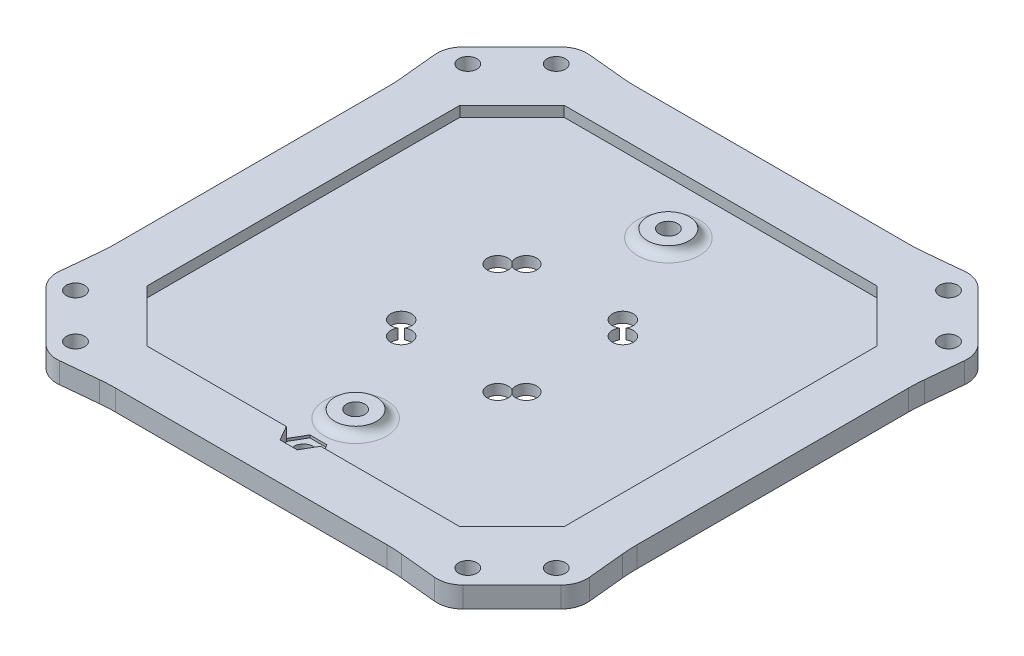
from build123d import *

# Parameters (mm, degrees)
SKETCH1_R                  = 1.75
BOSS_EXTRUDE1_DEPTH        = 4
CUT_EXTRUDE1_DEPTH         = 2
SKETCH4_R                  = 1.75
CUT_EXTRUDE3_DEPTH         = 73.238369544
BOSS_EXTRUDE2_START        = 1.5
SKETCH5_R                  = 4
SKETCH5_R_2                = 1.75
BOSS_EXTRUDE2_DEPTH        = 1.5
REDONDEO1_R                = 2
REDONDEO2_R                = 30
REDONDEO3_R                = 5
CORTAR_EXTRUIR2_DEPTH      = 2.5
CROQUIS1_R                 = 1.75
CORTAR_EXTRUIR1_DEPTH      = 5
CORTAR_EXTRUIR3_DEPTH      = 73.029377138
CORTAR_EXTRUIR3_DEPTH_BACK = 73.029377138
CROQUIS5_R                 = 2
CROQUIS6_W                 = 5.2
CROQUIS6_H                 = 3.2
CORTAR_EXTRUIR4_DEPTH      = 2.5


with BuildPart() as part:
    # Sketch1 → Boss-Extrude1 (new body)
    with BuildSketch(Plane(origin=(0, 0, 0), x_dir=(1, 0, 0), z_dir=(0, 1, 0))):
        Polygon((-27.516424079, 50), (27.516424079, 50), (38.33273811, 51.060660172), (51.060660172, 38.33273811), (50, 27.516424079), (50, -27.516424079), (51.060660172, -38.33273811), (38.33273811, -51.060660172), (27.516424079, -50), (-27.516424079, -50), (-38.33273811, -51.060660172), (-51.060660172, -38.33273811), (-50, -27.516424079), (-50, 27.516424079), (-51.060660172, 38.33273811), (-38.33273811, 51.060660172), align=None)
        with Locations(Location((37.625631329, 46.110912703, 0), (0, 0, 270))):
            Circle(SKETCH1_R, mode=Mode.SUBTRACT)
        with Locations(Location((46.110912703, 37.625631329, 0), (0, 0, 270))):
            Circle(SKETCH1_R, mode=Mode.SUBTRACT)
        with Locations(Location((37.625631329, -46.110912703, 0), (0, 0, 270))):
            Circle(SKETCH1_R, mode=Mode.SUBTRACT)
        with Locations(Location((46.110912703, -37.625631329, 0), (0, 0, 270))):
            Circle(SKETCH1_R, mode=Mode.SUBTRACT)
        with Locations(Location((-46.110912703, -37.625631329, 0), (0, 0, 270))):
            Circle(SKETCH1_R, mode=Mode.SUBTRACT)
        with Locations(Location((-37.625631329, -46.110912703, 0), (0, 0, 270))):
            Circle(SKETCH1_R, mode=Mode.SUBTRACT)
        with Locations(Location((-37.625631329, 46.110912703, 0), (0, 0, 270))):
            Circle(SKETCH1_R, mode=Mode.SUBTRACT)
        with Locations(Location((-46.110912703, 37.625631329, 0), (0, 0, 270))):
            Circle(SKETCH1_R, mode=Mode.SUBTRACT)
    extrude(amount=BOSS_EXTRUDE1_DEPTH)

    # Sketch2 → Cut-Extrude1 (cut)
    with BuildSketch(Plane(origin=(0, 4, 0), x_dir=(1, 0, 0), z_dir=(0, 1, 0))):
        Polygon((-40, -30), (-40, 30), (-30, 40), (30, 40), (40, 30), (40, -30), (30, -40), (-30, -40), align=None)
    extrude(amount=-CUT_EXTRUDE1_DEPTH, mode=Mode.SUBTRACT)

    # Sketch4 → Cut-Extrude3 (cut, through all)
    with BuildSketch(Plane(origin=(0, 2, 0), x_dir=(1, 0, 0), z_dir=(0, 1, 0))):
        with Locations(Location((0, 30, 0), (0, 0, 270))):
            Circle(SKETCH4_R)
    cut_extrude3 = extrude(amount=-CUT_EXTRUDE3_DEPTH, mode=Mode.SUBTRACT)

    # Sketch5 → Boss-Extrude2 (add)
    with BuildSketch(Plane(origin=(0, 2, 0), x_dir=(1, 0, 0), z_dir=(0, 1, 0)).offset(BOSS_EXTRUDE2_START)):
        with Locations(Location((0, 30, 0), (0, 0, 90))):
            Circle(SKETCH5_R)
        with Locations(Location((0, 30, 0), (0, 0, 270))):
            Circle(SKETCH5_R_2, mode=Mode.SUBTRACT)
    boss_extrude2 = extrude(amount=-BOSS_EXTRUDE2_DEPTH)

    # Simetría1: Cut-Extrude3, Boss-Extrude2 across plane
    add(cut_extrude3.mirror(Plane.XY), mode=Mode.SUBTRACT)
    add(boss_extrude2.mirror(Plane.XY))

    # Redondeo1
    # the kernel refuses this fillet: 2 mm, written as the material it adds along each edge
    with BuildSketch(Plane(origin=(0, 2, -30), x_dir=(0, 0, -1), z_dir=(1, 0, 0))) as redondeo1_piece_1:
        with BuildLine():
            CenterArc((5.936491673, 2), REDONDEO1_R, 194.477512186, 75.522487814)
            Line((4, 1.5), (3.961270167, 1.49))
            ThreePointArc((3.961270167, 1.49), (3.96, 0.75), (3.96, 0))
            Line((3.96, 0), (4, -0.04))
            Line((4, -0.04), (5.936491673, -0.04))
            Line((5.936491673, -0.04), (5.936491673, 0))
        make_face()
    revolve(axis=Axis((0, 2, -30), (0, 1, 0)))
    with BuildSketch(Plane(origin=(0, 2, 30), x_dir=(0, 0, 1), z_dir=(1, 0, 0))) as redondeo1_piece_2:
        with BuildLine():
            CenterArc((5.936491673, -2), REDONDEO1_R, 90, 75.522487814)
            Line((4, -1.5), (3.961270167, -1.49))
            ThreePointArc((3.961270167, -1.49), (3.96, -0.75), (3.96, 0))
            Line((3.96, 0), (4, 0.04))
            Line((4, 0.04), (5.936491673, 0.04))
            Line((5.936491673, 0.04), (5.936491673, 0))
        make_face()
    revolve(axis=Axis((0, 2, 30), (0, -1, 0)))

    # Redondeo2
    # the kernel refuses this fillet: 30 mm, written as the material it adds along each edge
    with BuildSketch(Plane(origin=(-27.516424079, 0, -50), x_dir=(1, 0, 0), z_dir=(0, 1, 0)), Plane(origin=(-27.516424079, 0, 50), x_dir=(-0.9952264052892461, 0, 0.09759304388656657), z_dir=(0, 1, 0)), Plane(origin=(-50, 0, 27.516424079), x_dir=(0, 0, -1), z_dir=(0, 1, 0)), Plane(origin=(-50, 0, -27.516424079), x_dir=(-0.09759304388655696, 0, -0.9952264052892469), z_dir=(0, 1, 0))) as redondeo2_piece_1:
        with BuildLine():
            CenterArc((REDONDEO2_R * 0.048913268002, REDONDEO2_R), REDONDEO2_R, 264.399415997, 5.600584003)
            Line((-REDONDEO2_R * 0.0486797758846, REDONDEO2_R * 0.00477359471075), (0, 0))
            Line((0, 0), (REDONDEO2_R * 0.048913268002, 0))
        make_face()
    extrude(amount=4)
    with BuildSketch(Plane(origin=(27.516424079, 0, -50), x_dir=(-1, 0, 0), z_dir=(0, 1, 0)), Plane(origin=(50, 0, -27.516424079), x_dir=(0.09759304388656798, 0, -0.9952264052892459), z_dir=(0, 1, 0)), Plane(origin=(50, 0, 27.516424079), x_dir=(0, 0, -1), z_dir=(0, 1, 0)), Plane(origin=(27.516424079, 0, 50), x_dir=(0.9952264052892461, 0, 0.09759304388656634), z_dir=(0, 1, 0))) as redondeo2_piece_2:
        with BuildLine():
            CenterArc((REDONDEO2_R * 0.048913268002, -REDONDEO2_R), REDONDEO2_R, 90, 5.600584003)
            Line((-REDONDEO2_R * 0.0486797758846, -REDONDEO2_R * 0.00477359471075), (0, 0))
            Line((0, 0), (REDONDEO2_R * 0.048913268002, 0))
        make_face()
    extrude(amount=4)

    # Redondeo3
    redondeo3_edges = [part.edges().sort_by_distance(p)[0] for p in [
        (38.33273811, 2, -51.060660172),
        (51.060660172, 2, -38.33273811),
        (51.060660172, 2, 38.33273811),
        (38.33273811, 2, 51.060660172),
        (-38.33273811, 2, 51.060660172),
        (-51.060660172, 2, 38.33273811),
        (-51.060660172, 2, -38.33273811),
        (-38.33273811, 2, -51.060660172),
    ]]
    fillet(redondeo3_edges, radius=REDONDEO3_R)

    # Croquis3 → Cortar-Extruir2 (cut)
    with BuildSketch(Plane(origin=(0, 4, 0), x_dir=(1, 0, 0), z_dir=(0, 1, 0))):
        Polygon((1.645448267, -37.15), (3.290896534, -40), (1.645448267, -42.85), (-1.645448267, -42.85), (-3.290896534, -40), (-1.645448267, -37.15), align=None)
    extrude(amount=-CORTAR_EXTRUIR2_DEPTH, mode=Mode.SUBTRACT)

    # Croquis1 → Cortar-Extruir1 (cut)
    with BuildSketch(Plane.XZ):
        with Locations(Location((0, 40, 0), (0, 0, 270))):
            Circle(CROQUIS1_R)
    extrude(amount=-CORTAR_EXTRUIR1_DEPTH, mode=Mode.SUBTRACT)

    # Croquis5 → Cortar-Extruir3 (cut, two sides: drawn at the far end of the back side and taken through both)
    with BuildSketch(Plane.XZ.offset(-CORTAR_EXTRUIR3_DEPTH_BACK)):
        with Locations((-12, -9.25)):
            Circle(CROQUIS5_R)
        with Locations((-12, 9.25)):
            Circle(CROQUIS5_R)
        with Locations((12, 9.25)):
            Circle(CROQUIS5_R)
        with Locations((12, -9.25)):
            Circle(CROQUIS5_R)
        with Locations((9.25, -12)):
            Circle(CROQUIS5_R)
        with Locations((-9.25, -12)):
            Circle(CROQUIS5_R)
        with Locations((9.25, 12)):
            Circle(CROQUIS5_R)
        with Locations((-9.25, 12)):
            Circle(CROQUIS5_R)
    extrude(amount=CORTAR_EXTRUIR3_DEPTH + CORTAR_EXTRUIR3_DEPTH_BACK, mode=Mode.SUBTRACT)

    # Croquis6 → Cortar-Extruir4 (cut)
    with BuildSketch(Plane.XZ):
        with Locations((-10, -41.9)):
            Rectangle(CROQUIS6_W, CROQUIS6_H)
        with Locations((10, -41.9)):
            Rectangle(CROQUIS6_W, CROQUIS6_H)
    extrude(amount=-CORTAR_EXTRUIR4_DEPTH, mode=Mode.SUBTRACT)


solid = part.part
